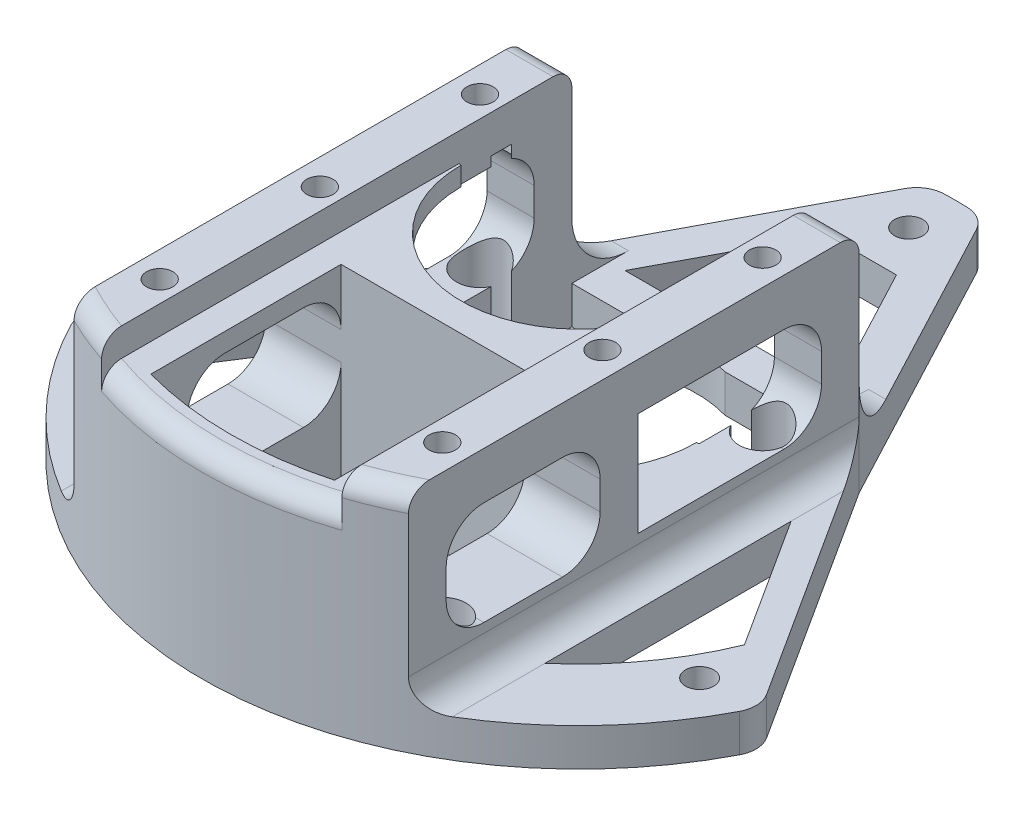
from build123d import *

# Parameters (mm, degrees)
SKETCH1_R               = 40
SKETCH1_R_2             = 1.5
BOSS_EXTRUDE1_DEPTH     = 4
BOSS_EXTRUDE2_START     = -20
SKETCH2_R               = 1.4
BOSS_EXTRUDE2_DEPTH     = 20
CUT_EXTRUDE1_START      = -3
CUT_EXTRUDE1_DEPTH      = 3
CUT_EXTRUDE2_DEPTH      = 61.340699366
CUT_EXTRUDE2_DEPTH_BACK = 61.340699366
SKETCH5_R               = 2.5
CUT_EXTRUDE3_DEPTH      = 20
CUT_EXTRUDE4_DEPTH      = 61
CUT_EXTRUDE4_DEPTH_BACK = 61
FILLET1_R               = 3
FILLET2_R               = 3
FILLET3_START           = 12.75
FILLET3_DEPTH           = 0.5137
FILLET3_START_2         = -13.2363
FILLET3_2_DEPTH         = 0.4863
FILLET3_START_3         = -17.75
FILLET3_3_DEPTH         = 4.5137
FILLET3_START_4         = 13.2637
FILLET3_4_DEPTH         = 4.4863
FILLET3_START_5         = 4
FILLET3_5_DEPTH         = 20
FILLET4_R               = 2
CUT_EXTRUDE6_START      = -35.5
CUT_EXTRUDE6_DEPTH      = 35.5
FILLET5_R               = 4


with BuildPart() as part:
    # Sketch1 → Boss-Extrude1 (new body)
    with BuildSketch(Plane(origin=(0, 0, 0), x_dir=(1, 0, 0), z_dir=(0, 1, 0))):
        with Locations(Location((0, 0, 0), (0, 0, 270))):
            Circle(SKETCH1_R)
        with Locations(Location((0, 35, 0), (0, 0, 270))):
            Circle(SKETCH1_R_2, mode=Mode.SUBTRACT)
        with Locations(Location((30.310889132, -17.5, 0), (0, 0, 270))):
            Circle(SKETCH1_R_2, mode=Mode.SUBTRACT)
        with Locations(Location((-30.310889132, -17.5, 0), (0, 0, 270))):
            Circle(SKETCH1_R_2, mode=Mode.SUBTRACT)
    extrude(amount=BOSS_EXTRUDE1_DEPTH)

    # Sketch2 → Boss-Extrude2 (add)
    with BuildSketch(Plane(origin=(0, 24, 0), x_dir=(1, 0, 0), z_dir=(0, 1, 0)).offset(BOSS_EXTRUDE2_START)):
        with BuildLine():
            Line((-3.5, 12), (-17.75, 12))
            Line((-17.75, 12), (-17.75, -35.846024884))
            ThreePointArc((-17.75, -35.846024884), (0, -40), (17.75, -35.846024884))
            Line((17.75, -35.846024884), (17.75, 12))
            Line((17.75, 12), (3.5, 12))
            ThreePointArc((3.5, 12), (10, 7.5), (12.5, 0))
            ThreePointArc((12.5, 0), (-7.5, -10), (-3.5, 12))
        make_face()
        with Locations(Location((-15, -29.5, 0), (0, 0, 270))):
            Circle(SKETCH2_R, mode=Mode.SUBTRACT)
        with Locations(Location((-15, -12.5, 0), (0, 0, 270))):
            Circle(SKETCH2_R, mode=Mode.SUBTRACT)
        with Locations(Location((15, -29.5, 0), (0, 0, 270))):
            Circle(SKETCH2_R, mode=Mode.SUBTRACT)
        with Locations(Location((15, -12.5, 0), (0, 0, 270))):
            Circle(SKETCH2_R, mode=Mode.SUBTRACT)
        with Locations(Location((-15, 4.5, 0), (0, 0, 270))):
            Circle(SKETCH2_R, mode=Mode.SUBTRACT)
        with Locations(Location((15, 4.5, 0), (0, 0, 270))):
            Circle(SKETCH2_R, mode=Mode.SUBTRACT)
    extrude(amount=BOSS_EXTRUDE2_DEPTH)

    # Cut-Extrude1: read off the stored shape, not the designer's step
    # Cut-Extrude1 outline → Cut-Extrude1 (cut)
    with BuildSketch(Plane(origin=(0, 24, 0), x_dir=(1, 0, 0), z_dir=(0, 1, 0)).offset(CUT_EXTRUDE1_START)):
        with BuildLine():
            Line((-3.5, 12), (-12.75, 12))
            Line((-12.75, 12), (-12.75, -37.913552986))
            ThreePointArc((-12.75, -37.913552986), (0, -40), (12.75, -37.913552986))
            Line((12.75, -37.913552986), (12.75, 12))
            Line((12.75, 12), (3.5, 12))
            ThreePointArc((3.5, 12), (0, -12.5), (-3.5, 12))
        make_face()
    extrude(amount=CUT_EXTRUDE1_DEPTH, mode=Mode.SUBTRACT)

    # Sketch4 → Cut-Extrude2 (cut, two sides: drawn at the far end of the back side and taken through both)
    with BuildSketch(Plane(origin=(0, 21, 0), x_dir=(1, 0, 0), z_dir=(0, 1, 0)).offset(-CUT_EXTRUDE2_DEPTH_BACK)):
        with BuildLine():
            Line((12.75, 12), (3.5, 12))
            ThreePointArc((3.5, 12), (10, 7.5), (12.5, 0))
            Line((12.5, 0), (12.75, 0))
            Line((12.75, 0), (12.75, 12))
        make_face()
        with BuildLine():
            ThreePointArc((-3.5, 12), (-10, 7.5), (-12.5, 0))
            ThreePointArc((-12.5, 0), (-8.838834757, -8.838834773), (2.2e-08, -12.5))
            ThreePointArc((2.2e-08, -12.5), (8.838834773, -8.838834757), (12.5, 0))
            ThreePointArc((12.5, 0), (10, 7.5), (3.5, 12))
            ThreePointArc((3.5, 12), (0, 12.5), (-3.5, 12))
        make_face()
        with BuildLine():
            Line((-12.75, 0), (-12.5, 0))
            ThreePointArc((-12.5, 0), (-10, 7.5), (-3.5, 12))
            Line((-3.5, 12), (-12.75, 12))
            Line((-12.75, 12), (-12.75, 0))
        make_face()
        with BuildLine():
            Line((-9.75, -15.5), (-9.75, -35.692261066))
            ThreePointArc((-9.75, -35.692261066), (0, -37), (9.75, -35.692261066))
            Line((9.75, -35.692261066), (9.75, -15.5))
            Line((9.75, -15.5), (-9.75, -15.5))
        make_face()
    extrude(amount=CUT_EXTRUDE2_DEPTH + CUT_EXTRUDE2_DEPTH_BACK, mode=Mode.SUBTRACT)

    # Sketch5 → Cut-Extrude3 (cut)
    with BuildSketch(Plane.XZ):
        with Locations((15, -4.5)):
            Circle(SKETCH5_R)
        with Locations(Location((15, 12.5, 0), (0, 0, 270))):
            Circle(SKETCH5_R)
        with Locations(Location((15, 29.5, 0), (0, 0, 270))):
            Circle(SKETCH5_R)
        with Locations(Location((-15, 29.5, 0), (0, 0, 270))):
            Circle(SKETCH5_R)
        with Locations(Location((-15, 12.5, 0), (0, 0, 270))):
            Circle(SKETCH5_R)
        with Locations((-15, -4.5)):
            Circle(SKETCH5_R)
    extrude(amount=-CUT_EXTRUDE3_DEPTH, mode=Mode.SUBTRACT)

    # Sketch6 → Cut-Extrude4 (cut, two sides: drawn at the far end of the back side and taken through both)
    with BuildSketch(Plane(origin=(0, 4, 0), x_dir=(1, 0, 0), z_dir=(0, 1, 0)).offset(-CUT_EXTRUDE4_DEPTH_BACK)):
        with BuildLine():
            Line((-20.75, 1.774935969), (-29.637523518, -12.067195189))
            ThreePointArc((-29.637523518, -12.067195189), (-25.932747906, -18.748135535), (-20.75, -24.360572653))
            Line((-20.75, -24.360572653), (-20.75, 1.774935969))
        make_face()
        with BuildLine():
            Line((-36.275994957, -16.853847925), (-17.75, 12))
            Line((-17.75, 12), (-3, 39.88734135))
            ThreePointArc((-3, 39.88734135), (-34.504225612, 20.235078822), (-36.275994957, -16.853847925))
        make_face()
        with BuildLine():
            ThreePointArc((36.275994957, -16.853847925), (34.504225612, 20.235078822), (3, 39.88734135))
            Line((3, 39.88734135), (17.75, 12))
            Line((17.75, 12), (36.275994957, -16.853847925))
        make_face()
        with BuildLine():
            Line((20.75, 1.774935969), (20.75, -24.360572653))
            ThreePointArc((20.75, -24.360572653), (25.932747906, -18.748135535), (29.637523518, -12.067195189))
            Line((29.637523518, -12.067195189), (20.75, 1.774935969))
        make_face()
        Polygon((-11.109303637, 16), (-3.704510279, 30), (3.704510279, 30), (11.109303637, 16), align=None)
    extrude(amount=CUT_EXTRUDE4_DEPTH + CUT_EXTRUDE4_DEPTH_BACK, mode=Mode.SUBTRACT)

    # Fillet1
    fillet1_edges = [part.edges().sort_by_distance(p)[0] for p in [
        (-36.275994957, 2, 16.853847925),
        (-3, 2, -39.88734135),
        (3, 2, -39.88734135),
        (36.275994957, 2, 16.853847925),
    ]]
    fillet(fillet1_edges, radius=FILLET1_R)

    # Fillet2
    # the kernel refuses this fillet: 3 mm, written as the material it adds along each edge
    with BuildSketch(Plane(origin=(17.75, 4, 43.346024884), x_dir=(1, 0, 0), z_dir=(0, 0, -1))) as fillet2_piece_1_section:
        with BuildLine():
            CenterArc((FILLET2_R, -FILLET2_R), FILLET2_R, 90, 90)
            Line((0, -FILLET2_R), (0, 0))
            Line((0, 0), (FILLET2_R, 0))
        make_face()
    fillet2_piece_1 = extrude(amount=55.346024884, mode=Mode.PRIVATE)
    fillet2_piece_1 = fillet2_piece_1 & Plane(origin=(0, 4, 0), x_dir=(0, 0, 1), z_dir=(0, -1, 0)) * Cylinder(40, 123, mode=Mode.PRIVATE)
    fillet2_piece_1 = split(fillet2_piece_1, bisect_by=Plane(origin=(42.912519831, 4, 27.190095987), z_dir=(-0.8414822249400659, 0, 0.5402847999989602)), keep=Keep.TOP, mode=Mode.PRIVATE)
    add(fillet2_piece_1)
    with BuildSketch(Plane(origin=(-17.75, 4, -12), x_dir=(-1, 0, 0), z_dir=(0, 0, 1))) as fillet2_piece_2_section:
        with BuildLine():
            CenterArc((FILLET2_R, -FILLET2_R), FILLET2_R, 90, 90)
            Line((0, -FILLET2_R), (0, 0))
            Line((0, 0), (FILLET2_R, 0))
        make_face()
    fillet2_piece_2 = extrude(amount=55.346024884, mode=Mode.PRIVATE)
    fillet2_piece_2 = fillet2_piece_2 & Plane(origin=(0, 4, 0), x_dir=(0, 0, 1), z_dir=(0, -1, 0)) * Cylinder(40, 123, mode=Mode.PRIVATE)
    fillet2_piece_2 = split(fillet2_piece_2, bisect_by=Plane(origin=(-17.75, 4, -12), z_dir=(0.8414822249400662, 0, 0.5402847999989597)), keep=Keep.TOP, mode=Mode.PRIVATE)
    add(fillet2_piece_2)

    # Fillet3: read off the stored shape, not the designer's step
    # Fillet3 outline → Fillet3 (add)
    with BuildSketch(Plane.YZ.offset(FILLET3_START)):
        with BuildLine():
            Line((4, -12), (4, -18))
            ThreePointArc((4, -18), (5.757359313, -13.757359313), (10, -12))
            Line((10, -12), (4, -12))
        make_face()
    extrude(amount=FILLET3_DEPTH)

    # Fillet3 2 outline → Fillet3 2 (add)
    with BuildSketch(Plane.YZ.offset(FILLET3_START_2)):
        with BuildLine():
            Line((4, -12), (4, -18))
            ThreePointArc((4, -18), (5.757359313, -13.757359313), (10, -12))
            Line((10, -12), (4, -12))
        make_face()
    extrude(amount=FILLET3_2_DEPTH)

    # Fillet3 3 outline → Fillet3 3 (add)
    with BuildSketch(Plane.YZ.offset(FILLET3_START_3)):
        with BuildLine():
            Line((4, -12), (4, -18))
            ThreePointArc((4, -18), (5.757359313, -13.757359313), (10, -12))
            Line((10, -12), (4, -12))
        make_face()
    extrude(amount=FILLET3_3_DEPTH)

    # Fillet3 4 outline → Fillet3 4 (add)
    with BuildSketch(Plane.YZ.offset(FILLET3_START_4)):
        with BuildLine():
            Line((4, -12), (4, -18))
            ThreePointArc((4, -18), (5.757359313, -13.757359313), (10, -12))
            Line((10, -12), (4, -12))
        make_face()
    extrude(amount=FILLET3_4_DEPTH)

    # Fillet3 5 outline → Fillet3 5 (cut)
    with BuildSketch(Plane(origin=(0, 0, 0), x_dir=(1, 0, 0), z_dir=(0, 1, 0)).offset(FILLET3_START_5)):
        Polygon((14.047603321, 19), (17.75, 12), (17.75, 19), align=None)
        Polygon((-17.75, 12), (-14.047603321, 19), (-17.75, 19), align=None)
    extrude(amount=FILLET3_5_DEPTH, mode=Mode.SUBTRACT)

    # Fillet4
    fillet4_edges = [part.edges().sort_by_distance(p)[0] for p in [
        (-15.25, 24, -12),
        (-15.284998139, 24, 36.964426573),
        (15.284998139, 24, 36.964426573),
        (15.25, 24, -12),
        (0, 21, 40),
    ]]
    fillet(fillet4_edges, radius=FILLET4_R)

    # Cut-Extrude6: read off the stored shape, not the designer's step
    # Cut-Extrude6 outline → Cut-Extrude6 (cut)
    with BuildSketch(Plane(origin=(17.75, 0, 0), x_dir=(0, 0, -1), z_dir=(1, 0, 0)).offset(CUT_EXTRUDE6_START)):
        Polygon((-15.5, 8.000002207), (-15.5, 19), (-31.846024884, 19), (-31.846024884, 8.000003743), align=None)
        Polygon((-11.5, 19), (-11.5, 8.000001832), (8, 8), (8, 19), align=None)
    extrude(amount=CUT_EXTRUDE6_DEPTH, mode=Mode.SUBTRACT)

    # Fillet5
    # the kernel refuses this fillet: 4 mm, written as the material it adds along each edge
    with BuildSketch(Plane(origin=(-17.75, 19, 31.846024884), x_dir=(0, 0, -1), z_dir=(1, 0, 0))) as fillet5_piece_1_section:
        with BuildLine():
            CenterArc((FILLET5_R, -FILLET5_R), FILLET5_R, 90, 90)
            Line((0, -FILLET5_R), (0, 0))
            Line((0, 0), (FILLET5_R, 0))
        make_face()
    fillet5_piece_1 = extrude(amount=11.886190273, mode=Mode.PRIVATE)
    fillet5_piece_1 = fillet5_piece_1 - Plane(origin=(-15, 19, 29.5), x_dir=(0, 0, -1), z_dir=(0, -1, 0)) * Cylinder(2.5, 40, mode=Mode.PRIVATE)
    fillet5_piece_1 = split(fillet5_piece_1, bisect_by=Plane(origin=(-9.75, 19, 31.846024884), z_dir=(-1, 0, 0)), keep=Keep.TOP, mode=Mode.PRIVATE)
    add(fillet5_piece_1)
    with BuildSketch(Plane(origin=(-24.136190273, 19, 31.846024884), x_dir=(0, 0, -1), z_dir=(1, 0, 0))) as fillet5_piece_2_section:
        with BuildLine():
            CenterArc((FILLET5_R, -FILLET5_R), FILLET5_R, 90, 90)
            Line((0, -FILLET5_R), (0, 0))
            Line((0, 0), (FILLET5_R, 0))
        make_face()
    fillet5_piece_2 = extrude(amount=14.386190273, mode=Mode.PRIVATE)
    fillet5_piece_2 = split(fillet5_piece_2, bisect_by=Plane(origin=(-17.75, 19, 31.846024884), z_dir=(1, 0, 0)), keep=Keep.TOP, mode=Mode.PRIVATE)
    fillet5_piece_2 = fillet5_piece_2 - Plane(origin=(-15, 19, 29.5), x_dir=(0, 0, -1), z_dir=(0, -1, 0)) * Cylinder(2.5, 45, mode=Mode.PRIVATE)
    add(fillet5_piece_2)
    with BuildSketch(Plane(origin=(-24.136189334, 8.000003743, 31.846024884), x_dir=(0, -9.396780015581331e-08, -0.9999999999999956), z_dir=(1, 0, 0))) as fillet5_piece_3_section:
        with BuildLine():
            CenterArc((FILLET5_R * 0.999999906032, FILLET5_R), FILLET5_R, 180.000005384, 89.999994616)
            Line((-FILLET5_R * 9.39677904377e-08, FILLET5_R * 0.999999906032), (0, 0))
            Line((0, 0), (FILLET5_R * 0.999999906032, 0))
        make_face()
    fillet5_piece_3 = extrude(amount=14.386189334, mode=Mode.PRIVATE)
    fillet5_piece_3 = split(fillet5_piece_3, bisect_by=Plane(origin=(-17.75, 8.000003743, 31.846024884), z_dir=(1, 0, 0)), keep=Keep.TOP, mode=Mode.PRIVATE)
    fillet5_piece_3 = fillet5_piece_3 - Plane(origin=(-15, 8.000003743, 29.5), x_dir=(0, 0, -1), z_dir=(0, -1, 0)) * Cylinder(2.5, 45, mode=Mode.PRIVATE)
    add(fillet5_piece_3)
    with BuildSketch(Plane(origin=(-17.75, 8.000003743, 31.846024884), x_dir=(0, 1, 0), z_dir=(1, 0, 0))) as fillet5_piece_4_section:
        with BuildLine():
            CenterArc((FILLET5_R * 0.999999906032, -FILLET5_R), FILLET5_R, 90, 89.999994616)
            Line((-FILLET5_R * 9.39677913259e-08, -FILLET5_R * 0.999999906032), (0, 0))
            Line((0, 0), (FILLET5_R * 0.999999906032, 0))
        make_face()
    fillet5_piece_4 = extrude(amount=11.886189334, mode=Mode.PRIVATE)
    fillet5_piece_4 = fillet5_piece_4 - Plane(origin=(-15, 8.000003743, 29.5), x_dir=(0, 0, -1), z_dir=(0, -1, 0)) * Cylinder(2.5, 40, mode=Mode.PRIVATE)
    fillet5_piece_4 = split(fillet5_piece_4, bisect_by=Plane(origin=(-9.75, 8.000003743, 31.846024884), z_dir=(-1, 0, 0)), keep=Keep.TOP, mode=Mode.PRIVATE)
    add(fillet5_piece_4)
    with BuildSketch(Plane(origin=(-17.75, 19, -8), x_dir=(0, -1, 0), z_dir=(1, 0, 0))) as fillet5_piece_5_section:
        with BuildLine():
            CenterArc((FILLET5_R, -FILLET5_R), FILLET5_R, 90, 90)
            Line((0, -FILLET5_R), (0, 0))
            Line((0, 0), (FILLET5_R, 0))
        make_face()
    fillet5_piece_5 = extrude(amount=5, mode=Mode.PRIVATE)
    fillet5_piece_5 = fillet5_piece_5 - Plane(origin=(-15, 19, -4.5), x_dir=(1, 0, 0), z_dir=(0, -1, 0)) * Cylinder(2.5, 27, mode=Mode.PRIVATE)
    add(fillet5_piece_5)
    with BuildSketch(Plane(origin=(-17.75, 8, -8), x_dir=(0, 9.394871819381462e-08, 0.9999999999999956), z_dir=(1, 0, 0))) as fillet5_piece_6_section:
        with BuildLine():
            CenterArc((FILLET5_R * 1.00000009395, -FILLET5_R), FILLET5_R, 90, 90.000005383)
            Line((FILLET5_R * 9.39487270202e-08, -FILLET5_R * 1.00000009395), (0, 0))
            Line((0, 0), (FILLET5_R * 1.00000009395, 0))
        make_face()
    fillet5_piece_6 = extrude(amount=5, mode=Mode.PRIVATE)
    fillet5_piece_6 = fillet5_piece_6 - Plane(origin=(-15, 8, -4.5), x_dir=(1, 0, 0), z_dir=(0, -1, 0)) * Cylinder(2.5, 27, mode=Mode.PRIVATE)
    add(fillet5_piece_6)
    with BuildSketch(Plane(origin=(12.75, 19, -8), x_dir=(0, 0, 1), z_dir=(1, 0, 0))) as fillet5_piece_7_section:
        with BuildLine():
            CenterArc((FILLET5_R, FILLET5_R), FILLET5_R, 180, 90)
            Line((0, FILLET5_R), (0, 0))
            Line((0, 0), (FILLET5_R, 0))
        make_face()
    fillet5_piece_7 = extrude(amount=5, mode=Mode.PRIVATE)
    fillet5_piece_7 = fillet5_piece_7 - Plane(origin=(15, 19, -4.5), x_dir=(1, 0, 0), z_dir=(0, -1, 0)) * Cylinder(2.5, 26, mode=Mode.PRIVATE)
    add(fillet5_piece_7)
    with BuildSketch(Plane(origin=(12.75, 8, -8), x_dir=(0, 1, 0), z_dir=(1, 0, 0))) as fillet5_piece_8_section:
        with BuildLine():
            CenterArc((FILLET5_R * 1.00000009395, FILLET5_R), FILLET5_R, 179.999994617, 90.000005383)
            Line((FILLET5_R * 9.39487270202e-08, FILLET5_R * 1.00000009395), (0, 0))
            Line((0, 0), (FILLET5_R * 1.00000009395, 0))
        make_face()
    fillet5_piece_8 = extrude(amount=5, mode=Mode.PRIVATE)
    fillet5_piece_8 = fillet5_piece_8 - Plane(origin=(15, 8, -4.5), x_dir=(1, 0, 0), z_dir=(0, -1, 0)) * Cylinder(2.5, 27, mode=Mode.PRIVATE)
    add(fillet5_piece_8)
    with BuildSketch(Plane(origin=(5.863810666, 8.000003743, 31.846024884), x_dir=(0, -9.396780015581331e-08, -0.9999999999999956), z_dir=(1, 0, 0))) as fillet5_piece_9_section:
        with BuildLine():
            CenterArc((FILLET5_R * 0.999999906032, FILLET5_R), FILLET5_R, 180.000005384, 89.999994616)
            Line((-FILLET5_R * 9.39677904377e-08, FILLET5_R * 0.999999906032), (0, 0))
            Line((0, 0), (FILLET5_R * 0.999999906032, 0))
        make_face()
    fillet5_piece_9 = extrude(amount=11.886189334, mode=Mode.PRIVATE)
    fillet5_piece_9 = fillet5_piece_9 - Plane(origin=(15, 8.000003743, 29.5), x_dir=(0, 0, -1), z_dir=(0, -1, 0)) * Cylinder(2.5, 40, mode=Mode.PRIVATE)
    fillet5_piece_9 = split(fillet5_piece_9, bisect_by=Plane(origin=(9.75, 8.000003743, 31.846024884), z_dir=(1, 0, 0)), keep=Keep.TOP, mode=Mode.PRIVATE)
    add(fillet5_piece_9)
    with BuildSketch(Plane(origin=(9.75, 8.000003743, 31.846024884), x_dir=(0, -9.396780015581331e-08, -0.9999999999999956), z_dir=(1, 0, 0))) as fillet5_piece_10_section:
        with BuildLine():
            CenterArc((FILLET5_R * 0.999999906032, FILLET5_R), FILLET5_R, 180.000005384, 89.999994616)
            Line((-FILLET5_R * 9.39677904377e-08, FILLET5_R * 0.999999906032), (0, 0))
            Line((0, 0), (FILLET5_R * 0.999999906032, 0))
        make_face()
    fillet5_piece_10 = extrude(amount=14.386189334, mode=Mode.PRIVATE)
    fillet5_piece_10 = split(fillet5_piece_10, bisect_by=Plane(origin=(17.75, 8.000003743, 31.846024884), z_dir=(-1, 0, 0)), keep=Keep.TOP, mode=Mode.PRIVATE)
    fillet5_piece_10 = fillet5_piece_10 - Plane(origin=(15, 8.000003743, 29.5), x_dir=(0, 0, -1), z_dir=(0, -1, 0)) * Cylinder(2.5, 45, mode=Mode.PRIVATE)
    add(fillet5_piece_10)
    with BuildSketch(Plane(origin=(9.75, 19, 31.846024884), x_dir=(0, 0, -1), z_dir=(1, 0, 0))) as fillet5_piece_11_section:
        with BuildLine():
            CenterArc((FILLET5_R, -FILLET5_R), FILLET5_R, 90, 90)
            Line((0, -FILLET5_R), (0, 0))
            Line((0, 0), (FILLET5_R, 0))
        make_face()
    fillet5_piece_11 = extrude(amount=14.386190273, mode=Mode.PRIVATE)
    fillet5_piece_11 = split(fillet5_piece_11, bisect_by=Plane(origin=(17.75, 19, 31.846024884), z_dir=(-1, 0, 0)), keep=Keep.TOP, mode=Mode.PRIVATE)
    fillet5_piece_11 = fillet5_piece_11 - Plane(origin=(15, 19, 29.5), x_dir=(0, 0, -1), z_dir=(0, -1, 0)) * Cylinder(2.5, 45, mode=Mode.PRIVATE)
    add(fillet5_piece_11)
    with BuildSketch(Plane(origin=(5.863809727, 19, 31.846024884), x_dir=(0, -1, 0), z_dir=(1, 0, 0))) as fillet5_piece_12_section:
        with BuildLine():
            CenterArc((FILLET5_R, FILLET5_R), FILLET5_R, 180, 90)
            Line((0, FILLET5_R), (0, 0))
            Line((0, 0), (FILLET5_R, 0))
        make_face()
    fillet5_piece_12 = extrude(amount=11.886190273, mode=Mode.PRIVATE)
    fillet5_piece_12 = fillet5_piece_12 - Plane(origin=(15, 19, 29.5), x_dir=(0, 0, -1), z_dir=(0, -1, 0)) * Cylinder(2.5, 40, mode=Mode.PRIVATE)
    fillet5_piece_12 = split(fillet5_piece_12, bisect_by=Plane(origin=(9.75, 19, 31.846024884), z_dir=(1, 0, 0)), keep=Keep.TOP, mode=Mode.PRIVATE)
    add(fillet5_piece_12)
    with BuildSketch(Plane(origin=(-17.75, 19, 15.5), x_dir=(0, -1, 0), z_dir=(1, 0, 0))) as fillet5_piece_13:
        with BuildLine():
            CenterArc((FILLET5_R, -FILLET5_R), FILLET5_R, 90, 90)
            Line((0, -FILLET5_R), (0, 0))
            Line((0, 0), (FILLET5_R, 0))
        make_face()
    extrude(amount=8)
    with BuildSketch(Plane(origin=(9.75, 19, 15.5), x_dir=(0, 0, 1), z_dir=(1, 0, 0))) as fillet5_piece_14:
        with BuildLine():
            CenterArc((FILLET5_R, FILLET5_R), FILLET5_R, 180, 90)
            Line((0, FILLET5_R), (0, 0))
            Line((0, 0), (FILLET5_R, 0))
        make_face()
    extrude(amount=8)
    with BuildSketch(Plane(origin=(-17.75, 8.000002207, 15.5), x_dir=(0, 1, 0), z_dir=(1, 0, 0))) as fillet5_piece_15:
        with BuildLine():
            CenterArc((FILLET5_R * 1.00000009397, FILLET5_R), FILLET5_R, 179.999994616, 90.000005384)
            Line((FILLET5_R * 9.39678090894e-08, FILLET5_R * 1.00000009397), (0, 0))
            Line((0, 0), (FILLET5_R * 1.00000009397, 0))
        make_face()
    extrude(amount=8)
    with BuildSketch(Plane(origin=(9.75, 8.000002207, 15.5), x_dir=(0, 9.396780025948684e-08, 0.9999999999999956), z_dir=(1, 0, 0))) as fillet5_piece_16:
        with BuildLine():
            CenterArc((FILLET5_R * 1.00000009397, -FILLET5_R), FILLET5_R, 90, 90.000005384)
            Line((FILLET5_R * 9.39678082013e-08, -FILLET5_R * 1.00000009397), (0, 0))
            Line((0, 0), (FILLET5_R * 1.00000009397, 0))
        make_face()
    extrude(amount=8)


solid = part.part
